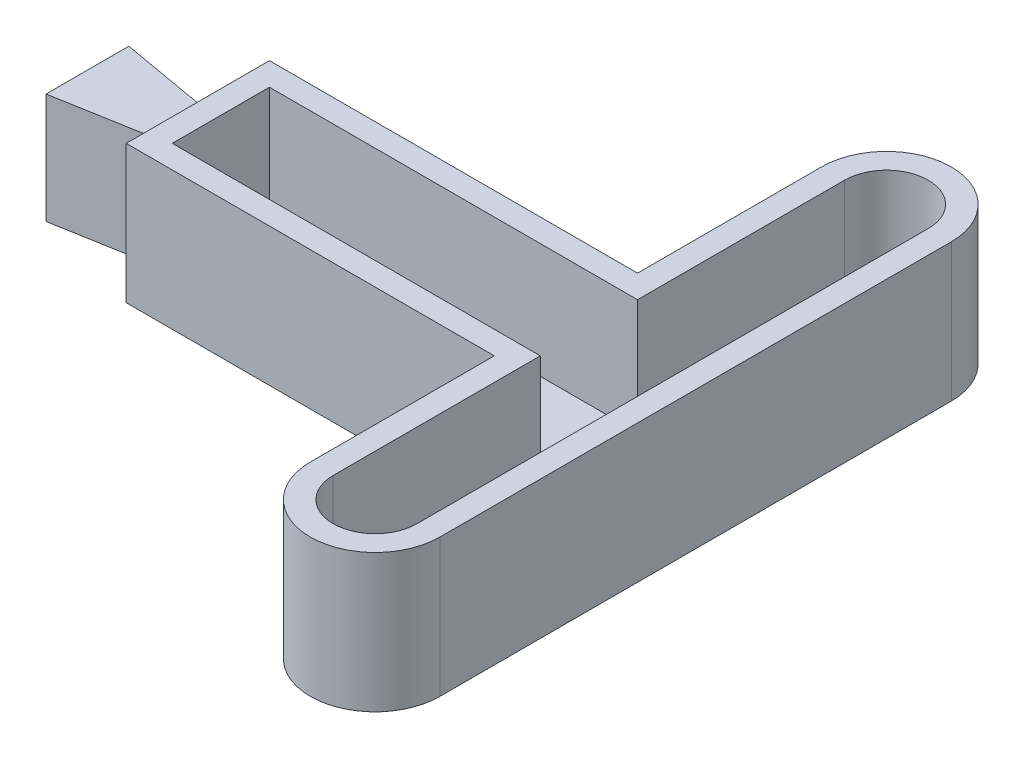
from build123d import *

# Parameters (mm, degrees)
BOSS_EXTRUDE1_DEPTH = 38.1
CUT_EXTRUDE10_DEPTH = 7.62
SHELL2_START        = 6.35
SHELL2_DEPTH        = 31.75
SHELL2_2_DEPTH      = 17.78


# Read off the part's stored shape, not the designer's step: Shell2
with BuildPart() as part:
    # Sketch1 → Boss-Extrude1 (new body)
    with BuildSketch(Plane(origin=(0, 0, 0), x_dir=(1, 0, 0), z_dir=(0, 1, 0))):
        with BuildLine():
            Line((0, 11.43), (0, -11.43))
            Line((0, -11.43), (30.48, -6.055553628))
            Line((30.48, -6.055553628), (30.48, -19.771553628))
            Line((30.48, -19.771553628), (132.08, -19.771553628))
            Line((132.08, -19.771553628), (132.08, -70.571553628))
            ThreePointArc((132.08, -70.571553628), (149.987, -88.478553628), (167.894, -70.571553628))
            Line((167.894, -70.571553628), (167.894, 70.571553628))
            ThreePointArc((167.894, 70.571553628), (149.987, 88.478553628), (132.08, 70.571553628))
            Line((132.08, 70.571553628), (132.08, 19.771553628))
            Line((132.08, 19.771553628), (30.48, 19.771553628))
            Line((30.48, 19.771553628), (30.48, 6.055553628))
            Line((30.48, 6.055553628), (0, 11.43))
        make_face()
    extrude(amount=BOSS_EXTRUDE1_DEPTH)

    # Sketch5 → Cut-Extrude10 (cut)
    with BuildSketch(Plane(origin=(0, 38.1, 0), x_dir=(1, 0, 0), z_dir=(0, 1, 0))):
        Polygon((0, -11.43), (0, 11.43), (0.205611809, 11.576348711), (30.48, 6.055553628), (30.48, -6.055553628), align=None)
    extrude(amount=-CUT_EXTRUDE10_DEPTH, mode=Mode.SUBTRACT)

    # Shell2 outline → Shell2 (cut)
    with BuildSketch(Plane(origin=(0, 0, 0), x_dir=(1, 0, 0), z_dir=(0, 1, 0)).offset(SHELL2_START)):
        with BuildLine():
            Line((36.83, 13.421553628), (36.83, -13.421553628))
            Line((36.83, -13.421553628), (138.43, -13.421553628))
            Line((138.43, -13.421553628), (138.43, -70.571553628))
            ThreePointArc((138.43, -70.571553628), (149.987, -82.128553628), (161.544, -70.571553628))
            Line((161.544, -70.571553628), (161.544, 70.571553628))
            ThreePointArc((161.544, 70.571553628), (149.987, 82.128553628), (138.43, 70.571553628))
            Line((138.43, 70.571553628), (138.43, 13.421553628))
            Line((138.43, 13.421553628), (36.83, 13.421553628))
        make_face()
    extrude(amount=SHELL2_DEPTH, mode=Mode.SUBTRACT)

    # Shell2 2 outline → Shell2 2 (cut)
    with BuildSketch(Plane(origin=(0, 0, 0), x_dir=(1, 0, 0), z_dir=(0, 1, 0)).offset(SHELL2_START)):
        Polygon((28.25455863, 0), (6.35, 3.862364687), (6.35, -3.862364687), align=None)
    extrude(amount=SHELL2_2_DEPTH, mode=Mode.SUBTRACT)


solid = part.part
